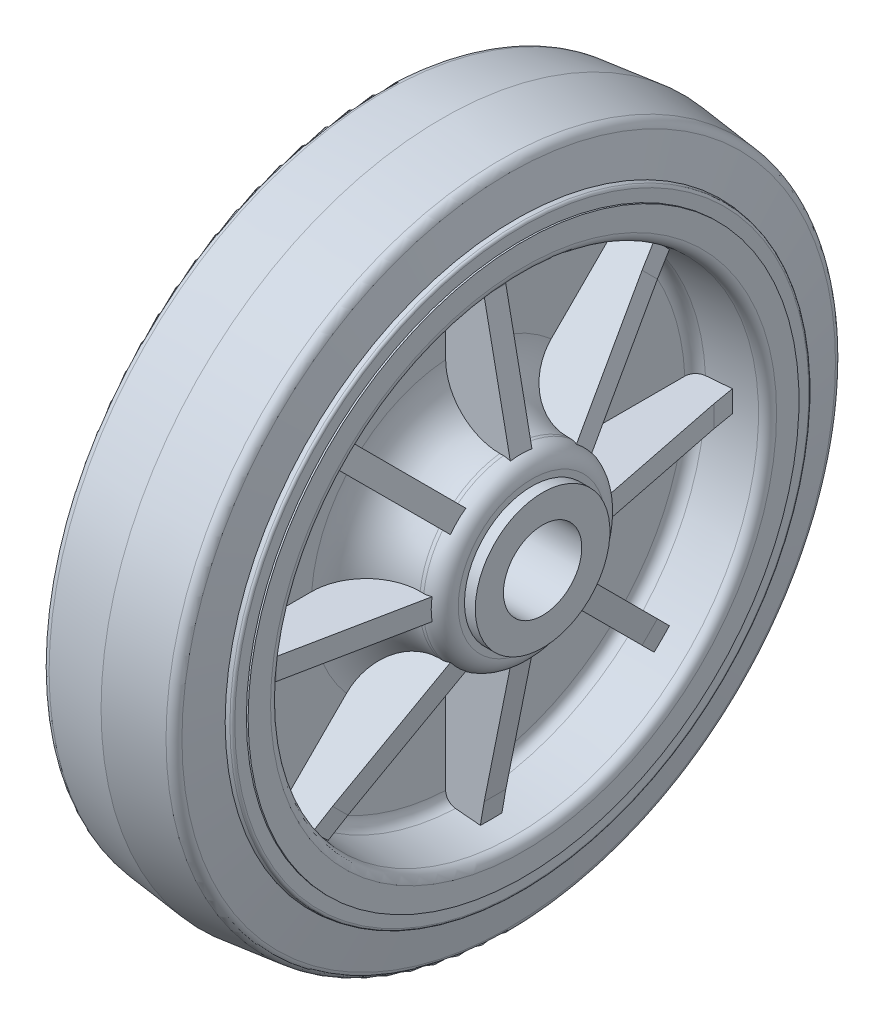
from build123d import *

# Parameters (mm, degrees)
RIB4_START               = -3.175
RIB4_DEPTH               = 6.35
CIRPATTERN1_COUNT        = 8
CIRPATTERN1_START        = -3.175
CIRPATTERN1_COPY_1_DEPTH = 6.35
CIRPATTERN1_COPY_2_DEPTH = 6.35
CIRPATTERN1_COPY_3_DEPTH = 6.35
CIRPATTERN1_COPY_4_DEPTH = 6.35
CIRPATTERN1_COPY_5_DEPTH = 6.35
CIRPATTERN1_COPY_6_DEPTH = 6.35
CIRPATTERN1_COPY_7_DEPTH = 6.35


# Read off the part's stored shape, not the designer's step: Rib4
with BuildPart() as part:
    # Sketch1 → Revolve2 (revolve)
    with BuildSketch(Plane.XY, mode=Mode.PRIVATE) as revolve2_sk:
        with BuildLine():
            Line((29.5275, 11.5), (29.5275, 19.755))
            Line((29.5275, 19.755), (26.3525, 19.755))
            Line((26.3525, 19.755), (26.3525, 21.580625))
            ThreePointArc((26.3525, 21.580625), (24.841354049, 25.228854049), (21.193125, 26.74))
            Line((21.193125, 26.74), (20.1295, 26.74))
            ThreePointArc((20.1295, 26.74), (8.904179849, 31.389679849), (4.2545, 42.615))
            Line((4.2545, 42.615), (4.2545, 67.092532707))
            ThreePointArc((4.2545, 67.092532707), (5.088644456, 69.237531616), (7.152780517, 70.255450874))
            Line((7.152780517, 70.255450874), (21.403504548, 71.502227673))
            ThreePointArc((21.403504548, 71.502227673), (23.209623601, 72.392907023), (23.9395, 74.269781069))
            Line((23.9395, 74.269781069), (23.9395, 80.8482))
            Line((23.9395, 80.8482), (23.4315, 80.8482))
            Line((23.4315, 80.8482), (23.4315, 84.246164668))
            ThreePointArc((23.4315, 84.246164668), (23.245797777, 84.756377333), (22.775583241, 85.027855822))
            Line((22.775583241, 85.027855822), (21.59, 85.236906135))
            Line((21.59, 85.236906135), (19.582192822, 95.91673155))
            ThreePointArc((19.582192822, 95.91673155), (18.741410563, 97.440032205), (17.159471499, 98.164482679))
            Line((17.159471499, 98.164482679), (0, 100.076))
            Line((0, 100.076), (-17.159471499, 98.164482679))
            ThreePointArc((-17.159471499, 98.164482679), (-18.741410563, 97.440032205), (-19.582192822, 95.91673155))
            Line((-19.582192822, 95.91673155), (-21.59, 85.236906135))
            Line((-21.59, 85.236906135), (-22.775583241, 85.027855822))
            ThreePointArc((-22.775583241, 85.027855822), (-23.245797777, 84.756377333), (-23.4315, 84.246164668))
            Line((-23.4315, 84.246164668), (-23.4315, 80.8482))
            Line((-23.4315, 80.8482), (-23.9395, 80.8482))
            Line((-23.9395, 80.8482), (-23.9395, 74.269781069))
            ThreePointArc((-23.9395, 74.269781069), (-23.209623601, 72.392907023), (-21.403504548, 71.502227673))
            Line((-21.403504548, 71.502227673), (-7.152780517, 70.255450874))
            ThreePointArc((-7.152780517, 70.255450874), (-5.088644456, 69.237531616), (-4.2545, 67.092532707))
            Line((-4.2545, 67.092532707), (-4.2545, 42.615))
            ThreePointArc((-4.2545, 42.615), (-8.904179849, 31.389679849), (-20.1295, 26.74))
            Line((-20.1295, 26.74), (-21.193125, 26.74))
            ThreePointArc((-21.193125, 26.74), (-24.841354049, 25.228854049), (-26.3525, 21.580625))
            Line((-26.3525, 21.580625), (-26.3525, 19.755))
            Line((-26.3525, 19.755), (-29.5275, 19.755))
            Line((-29.5275, 19.755), (-29.5275, 11.5))
            Line((-29.5275, 11.5), (29.5275, 11.5))
        make_face()
    revolve(revolve2_sk.sketch.rotate(Axis((-29.5275, 0, 0), (1, 0, 0)), 90), axis=Axis((-29.5275, 0, 0), (1, 0, 0)))

    # Rib4 outline → Rib4 (add)
    with BuildSketch(Plane.XY.offset(RIB4_START)):
        Polygon((15.5575, 64.237636689), (14.4145, 70.890769006), (14.223935471, 72), (4.2545, 72), (4.2545, 25), (23.447581657, 25), (23.219723216, 26.133147553), align=None)
    rib4 = extrude(amount=RIB4_DEPTH)

    # Mirror1: Rib4 across plane
    add(rib4.mirror(Plane(origin=(0, 0, 0), x_dir=(0, 0, 1), z_dir=(1, 0, 0))))

    # CirPattern1: Rib4 ×8 about axis
    cirpattern1_axis = Axis((0, 0, 0), (1, 0, 0))
    for i in range(1, CIRPATTERN1_COUNT):
        add(rib4.rotate(cirpattern1_axis, i * 360 / CIRPATTERN1_COUNT))

    # CirPattern1 copy 1 sketch → CirPattern1 copy 1 (add)
    with BuildSketch(Plane(origin=(0, 0, 0), x_dir=(-1, 0, 0), z_dir=(0, -0.7071067811865475, 0.7071067811865476)).offset(CIRPATTERN1_START)):
        Polygon((15.5575, -64.237636689), (14.4145, -70.890769006), (14.223935471, -72), (4.2545, -72), (4.2545, -25), (23.447581657, -25), (23.219723216, -26.133147553), align=None)
    extrude(amount=CIRPATTERN1_COPY_1_DEPTH)

    # CirPattern1 copy 2 sketch → CirPattern1 copy 2 (add)
    with BuildSketch(Plane(origin=(0, 0, 0), x_dir=(-1, 0, 0), z_dir=(0, -1, 0)).offset(CIRPATTERN1_START)):
        Polygon((15.5575, -64.237636689), (14.4145, -70.890769006), (14.223935471, -72), (4.2545, -72), (4.2545, -25), (23.447581657, -25), (23.219723216, -26.133147553), align=None)
    extrude(amount=CIRPATTERN1_COPY_2_DEPTH)

    # CirPattern1 copy 3 sketch → CirPattern1 copy 3 (add)
    with BuildSketch(Plane(origin=(0, 0, 0), x_dir=(-1, 0, 0), z_dir=(0, -0.7071067811865476, -0.7071067811865475)).offset(CIRPATTERN1_START)):
        Polygon((15.5575, -64.237636689), (14.4145, -70.890769006), (14.223935471, -72), (4.2545, -72), (4.2545, -25), (23.447581657, -25), (23.219723216, -26.133147553), align=None)
    extrude(amount=CIRPATTERN1_COPY_3_DEPTH)

    # CirPattern1 copy 4 sketch → CirPattern1 copy 4 (add)
    with BuildSketch(Plane(origin=(0, 0, 0), x_dir=(-1, 0, 0), z_dir=(0, 0, -1)).offset(CIRPATTERN1_START)):
        Polygon((15.5575, -64.237636689), (14.4145, -70.890769006), (14.223935471, -72), (4.2545, -72), (4.2545, -25), (23.447581657, -25), (23.219723216, -26.133147553), align=None)
    extrude(amount=CIRPATTERN1_COPY_4_DEPTH)

    # CirPattern1 copy 5 sketch → CirPattern1 copy 5 (add)
    with BuildSketch(Plane(origin=(0, 0, 0), x_dir=(-1, 0, 0), z_dir=(0, 0.7071067811865475, -0.7071067811865477)).offset(CIRPATTERN1_START)):
        Polygon((15.5575, -64.237636689), (14.4145, -70.890769006), (14.223935471, -72), (4.2545, -72), (4.2545, -25), (23.447581657, -25), (23.219723216, -26.133147553), align=None)
    extrude(amount=CIRPATTERN1_COPY_5_DEPTH)

    # CirPattern1 copy 6 sketch → CirPattern1 copy 6 (add)
    with BuildSketch(Plane(origin=(0, 0, 0), x_dir=(-1, 0, 0), z_dir=(0, 1, 0)).offset(CIRPATTERN1_START)):
        Polygon((15.5575, -64.237636689), (14.4145, -70.890769006), (14.223935471, -72), (4.2545, -72), (4.2545, -25), (23.447581657, -25), (23.219723216, -26.133147553), align=None)
    extrude(amount=CIRPATTERN1_COPY_6_DEPTH)

    # CirPattern1 copy 7 sketch → CirPattern1 copy 7 (add)
    with BuildSketch(Plane(origin=(0, 0, 0), x_dir=(-1, 0, 0), z_dir=(0, 0.7071067811865477, 0.7071067811865474)).offset(CIRPATTERN1_START)):
        Polygon((15.5575, -64.237636689), (14.4145, -70.890769006), (14.223935471, -72), (4.2545, -72), (4.2545, -25), (23.447581657, -25), (23.219723216, -26.133147553), align=None)
    extrude(amount=CIRPATTERN1_COPY_7_DEPTH)


solid = part.part
